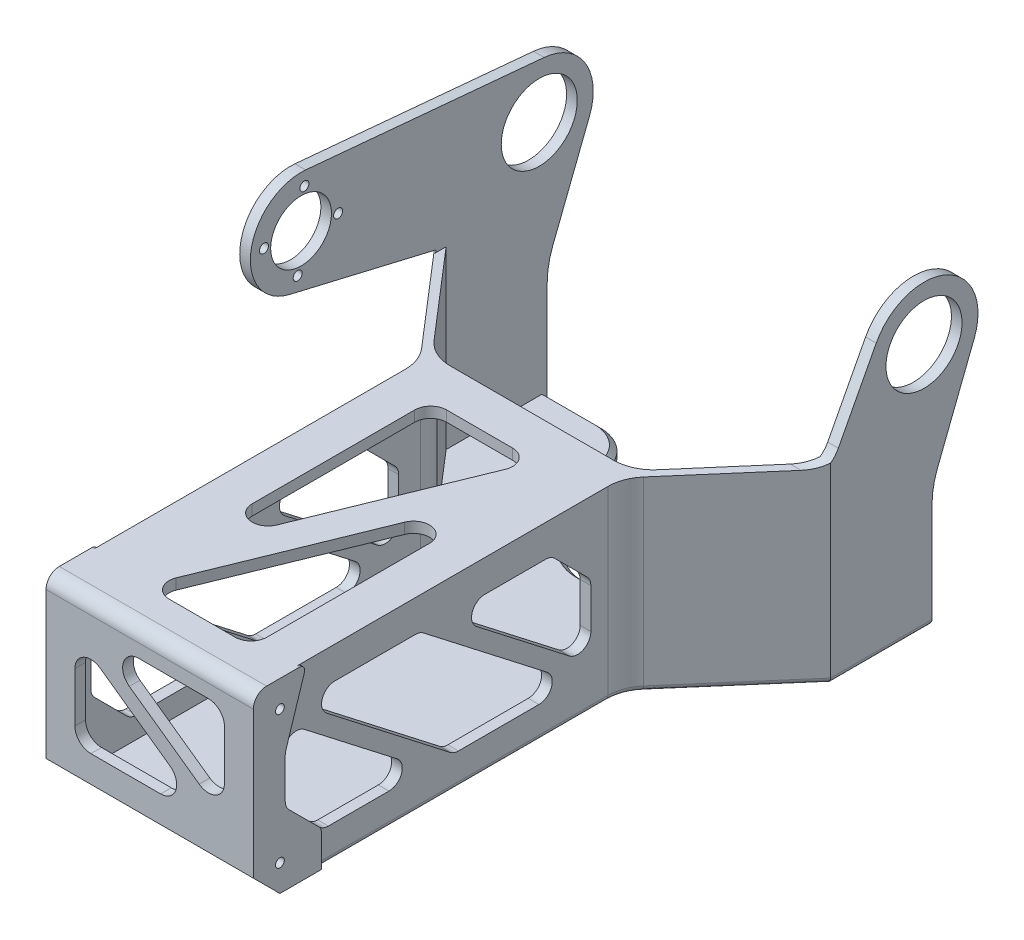
from build123d import *

# Parameters (mm, degrees)
BOSS_EXTRUDE1_DEPTH = 76
SKETCH2_W           = 148.59
SKETCH2_H           = 70
BOSS_EXTRUDE2_DEPTH = 4
SKETCH3_R           = 1.5499999999999932
CUT_EXTRUDE1_DEPTH  = 183.69917378028836
BOSS_EXTRUDE3_DEPTH = 70
CUT_EXTRUDE2_DEPTH  = 275.3120086689608
BOSS_EXTRUDE4_DEPTH = 66
CHAMFER1_SIZE       = 10
SHELL2_START        = 11.656854249
SHELL2_DEPTH        = 54.343145751
SHELL2_START_2      = 40.195
SHELL2_2_DEPTH      = 68.2
SHELL2_START_3      = 4
SHELL2_3_DEPTH      = 7.656854249
CUT_EXTRUDE3_DEPTH  = 10
FILLET4_R           = 15
FILLET5_R           = 15
SKETCH10_R          = 14.287500000000005
BOSS_EXTRUDE5_DEPTH = 4
FILLET8_R           = 30
SKETCH12_R          = 1.7000000000000146
SKETCH12_R_2        = 1.7000000000000066
SKETCH12_R_3        = 1.7000000000000015
SKETCH12_R_4        = 11.430000000000005
BOSS_EXTRUDE6_DEPTH = 4
CUT_EXTRUDE4_DEPTH  = 276.0616936327746
CHAMFER2_SIZE       = 15
FILLET9_R           = 5
FILLET10_R          = 5
FILLET11_R          = 5
CUT_EXTRUDE5_DEPTH  = 10
FILLET12_R          = 6
CUT_EXTRUDE7_DEPTH  = 10
FILLET13_R          = 6
SKETCH16_R          = 1.6500000000000166
SKETCH16_R_2        = 1.6499999999999886
CUT_EXTRUDE8_DEPTH  = 276.0616936327746
SKETCH17_R          = 1.6500000000000166
SKETCH17_R_2        = 1.6499999999999886
BOSS_EXTRUDE7_DEPTH = 0.85
FILLET14_R          = 15
FILLET15_R          = 15
FILLET16_R          = 15
FILLET17_R          = 5
FILLET18_R          = 2
CHAMFER3_SIZE       = 2
FILLET19_R          = 2
FILLET20_R          = 2
FILLET21_R          = 10
FILLET22_R          = 0.5


with BuildPart() as part:
    # Sketch1 → Boss-Extrude1 (new body)
    with BuildSketch(Plane.XY):
        Polygon((4, 4), (4, 66), (4, 70), (0, 70), (0, 0), (148.59, 0), (148.59, 70), (144.59, 70), (144.59, 66), (144.59, 4), align=None)
    extrude(amount=BOSS_EXTRUDE1_DEPTH)

    # Sketch2 → Boss-Extrude2 (add)
    with BuildSketch(Plane.XY.offset(76)):
        with Locations((74.295, 35)):
            Rectangle(SKETCH2_W, SKETCH2_H)
    extrude(amount=BOSS_EXTRUDE2_DEPTH)

    # Sketch3 → Cut-Extrude1 (cut, through all)
    with BuildSketch(Plane(origin=(148.59, 0, 0), x_dir=(0, 0, -1), z_dir=(1, 0, 0))):
        with Locations((-70, 60.00000000000001)):
            Circle(SKETCH3_R)
        with Locations((-65.08996776509676, 59.055763031749386)):
            Circle(SKETCH3_R)
    extrude(amount=-CUT_EXTRUDE1_DEPTH, mode=Mode.SUBTRACT)

    # Sketch4 → Boss-Extrude3 (add)
    with BuildSketch(Plane.XZ):
        Polygon((36.195000000000036, 80), (112.39500000000002, 80), (112.39500000000001, 219.70000000000002), (36.195000000000014, 219.70000000000002), align=None)
    extrude(amount=-BOSS_EXTRUDE3_DEPTH)

    # Sketch5 → Cut-Extrude2 (cut, through all)
    with BuildSketch(Plane(origin=(0, 70, 0), x_dir=(1, 0, 0), z_dir=(0, 1, 0))):
        Polygon((144.59, -76), (144.59, -42.73047382235106), (115.85036992840097, -76), align=None)
        Polygon((148.59, -80), (148.59, -38.1), (144.59, -42.73047382235105), (144.59, -76), (115.85036992840097, -76), (112.39500000000002, -80), align=None)
        Polygon((32.747857142857136, -75.99999999999997), (3.999999999999995, -42.64152507252382), (4, -76), align=None)
        Polygon((3.999999999999995, -42.64152507252382), (0, -38), (0, -80), (36.19500000000002, -80), (32.747857142857136, -75.99999999999997), (4, -76), align=None)
    extrude(amount=-CUT_EXTRUDE2_DEPTH, mode=Mode.SUBTRACT)

    # Sketch5<3> → Boss-Extrude4 (add)
    with BuildSketch(Plane(origin=(0, 70, 0), x_dir=(1, 0, 0), z_dir=(0, 1, 0))):
        Polygon((144.59, -42.73047382235106), (144.59, -38), (111.84214285714287, -76), (115.85036992840097, -76), align=None)
        Polygon((4, -38), (4, -42.64152507252382), (32.747857142857136, -75.99999999999997), (36.747857142857185, -76), align=None)
    extrude(amount=-BOSS_EXTRUDE4_DEPTH)

    # Chamfer1
    chamfer1_edges = [part.edges().sort_by_distance(p)[0] for p in [
        (74.29500000000002, 0, 219.70000000000002),
    ]]
    chamfer(chamfer1_edges, length=CHAMFER1_SIZE)

    # Shell2: read off the stored shape, not the designer's step
    # Shell2 outline → Shell2 (cut)
    with BuildSketch(Plane(origin=(0, 0, 0), x_dir=(1, 0, 0), z_dir=(0, 1, 0)).offset(SHELL2_START)):
        Polygon((40.195, -215.7), (108.395, -215.7), (108.395, -78.511545173), (110.564579416, -76), (38.028273213, -76), (40.195, -78.514229176), align=None)
    extrude(amount=SHELL2_DEPTH, mode=Mode.SUBTRACT)

    # Shell2 2 outline → Shell2 2 (cut)
    with BuildSketch(Plane.YZ.offset(SHELL2_START_2)):
        Polygon((11.656854249, 215.7), (4, 208.043145751), (4, 76), (11.656854249, 76), align=None)
    extrude(amount=SHELL2_2_DEPTH, mode=Mode.SUBTRACT)

    # Shell2 3 outline → Shell2 3 (cut)
    with BuildSketch(Plane(origin=(0, 0, 0), x_dir=(1, 0, 0), z_dir=(0, 1, 0)).offset(SHELL2_START_3)):
        Polygon((40.195, -76), (38.028273213, -76), (40.195, -78.514229176), align=None)
        Polygon((110.564579416, -76), (108.395, -76), (108.395, -78.511545173), align=None)
    extrude(amount=SHELL2_3_DEPTH, mode=Mode.SUBTRACT)

    # Sketch8 → Cut-Extrude3 (cut)
    with BuildSketch(Plane(origin=(0, 4, 0), x_dir=(1, 0, 0), z_dir=(0, 1, 0))):
        Polygon((109.58999999999999, 0), (39, 0), (39.00000000000001, -24.999505293349024), (63.26091939608469, -53.151421708200694), (85.32908060391533, -53.15142170820071), (109.58999999999999, -24.99950529334902), align=None)
    extrude(amount=-CUT_EXTRUDE3_DEPTH, mode=Mode.SUBTRACT)

    # Fillet4
    fillet4_edges = [part.edges().sort_by_distance(p)[0] for p in [
        (85.32908060391533, 2, 53.15142170820071),
        (63.26091939608469, 2, 53.151421708200694),
    ]]
    fillet(fillet4_edges, radius=FILLET4_R)

    # Fillet5
    fillet5_edges = [part.edges().sort_by_distance(p)[0] for p in [
        (109.58999999999999, 2, 0),
        (39, 2, 0),
        (109.58999999999999, 2, 24.99950529334902),
        (39.00000000000001, 2, 24.999505293349024),
    ]]
    fillet(fillet5_edges, radius=FILLET5_R)

    # Sketch10 → Boss-Extrude5 (add)
    with BuildSketch(Plane.ZY):
        with BuildLine():
            Line((0, 45.00000000000001), (0, 70))
            Line((0, 70), (38, 70))
            Line((38, 70), (20.959871671983425, 102.43534131740273))
            ThreePointArc((20.959871671983425, 102.43534131740273), (-5.427511917217222, 111.45425964744081), (-15.892146352821499, 85.60611993378485))
            Line((-15.892146352821499, 85.60611993378485), (0, 45.00000000000001))
        make_face()
        with Locations((2.9999999999999933, 93)):
            Circle(SKETCH10_R, mode=Mode.SUBTRACT)
    boss_extrude5 = extrude(amount=-BOSS_EXTRUDE5_DEPTH)

    # Mirror1: Boss-Extrude5 across plane
    add(boss_extrude5.mirror(Plane.ZY.offset(-74.29500000000004)))

    # Fillet8
    fillet8_edges = [part.edges().sort_by_distance(p)[0] for p in [
        (2, 45.00000000000001, 0),
        (146.5900000000001, 45.00000000000001, 1.795e-14),
    ]]
    fillet(fillet8_edges, radius=FILLET8_R)

    # Sketch12 → Boss-Extrude6 (add)
    with BuildSketch(Plane.ZY):
        with BuildLine():
            Line((90.76820759029594, 121.40410157682716), (1.151178688988905, 113.20308184436105))
            ThreePointArc((1.1511786889889044, 113.20308184436105), (12.689042496031862, 110.82428432672933), (20.959871646987697, 102.4353413649813))
            Line((20.9598716469877, 102.4353413649813), (38, 70))
            Line((38, 70), (96.87897356250058, 83.89248769804969))
            ThreePointArc((96.87897356250066, 83.89248769804931), (111.30640681817987, 105.49630322842616), (90.76820759029599, 121.40410157682683))
        make_face()
        with Locations((91.23484052030747, 116.37108217392239)):
            Circle(SKETCH12_R, mode=Mode.SUBTRACT)
        with Locations((93.77366791719297, 88.4956585881036)):
            Circle(SKETCH12_R_2, mode=Mode.SUBTRACT)
        with Locations((78.56654242584088, 101.16395668257017)):
            Circle(SKETCH12_R_3, mode=Mode.SUBTRACT)
        with Locations((92.5042542187503, 102.43337038101281)):
            Circle(SKETCH12_R_4, mode=Mode.SUBTRACT)
        with Locations((106.44196601165967, 103.70278407945571)):
            Circle(SKETCH12_R, mode=Mode.SUBTRACT)
    extrude(amount=-BOSS_EXTRUDE6_DEPTH)

    # Sketch13 → Cut-Extrude4 (cut, through all)
    with BuildSketch(Plane(origin=(112.39500000000004, 0, 1.117e-14), x_dir=(1e-16, 0, -1), z_dir=(1, 0, 1e-16))):
        Polygon((-202.80362192896834, 58.00000000000002), (-143.4683405547297, 12.000000000000014), (-96.89637807103179, 12), (-156.23165944527034, 58.00000000000002), align=None)
        Polygon((-153.26109669679317, 12.000000000000014), (-207.7, 54.20405623684717), (-207.7, 15), (-207.7, 12), align=None)
        Polygon((-91.99999999999999, 58.00000000000001), (-146.4389033032069, 58.00000000000001), (-91.99999999999999, 15.795943763152833), align=None)
    extrude(amount=-CUT_EXTRUDE4_DEPTH, mode=Mode.SUBTRACT)

    # Chamfer2
    chamfer2_edges = [part.edges().sort_by_distance(p)[0] for p in [
        (38.19500000000002, 58.00000000000001, 91.99999999999999),
        (110.39500000000001, 58.00000000000001, 92),
        (38.19500000000001, 12, 207.7),
        (110.39500000000001, 12, 207.7),
    ]]
    chamfer(chamfer2_edges, length=CHAMFER2_SIZE)

    # Fillet9
    fillet9_edges = [part.edges().sort_by_distance(p)[0] for p in [
        (38.19500000000002, 12.000000000000007, 143.4683405547297),
        (38.19500000000001, 58.00000000000002, 202.80362192896834),
        (38.19500000000001, 58.000000000000014, 156.23165944527034),
        (38.19500000000002, 12.000000000000014, 96.89637807103179),
        (38.19500000000002, 15.795943763152833, 91.99999999999999),
        (38.19500000000002, 58.000000000000014, 146.4389033032069),
        (38.19500000000001, 12.000000000000014, 153.26109669679317),
        (38.195000000000014, 58.00000000000001, 106.99999999999999),
        (38.19500000000002, 43.00000000000001, 91.99999999999999),
        (38.19500000000001, 12, 192.7),
        (38.19500000000001, 26.999999999999996, 207.7),
    ]]
    fillet(fillet9_edges, radius=FILLET9_R)

    # Fillet10
    fillet10_edges = [part.edges().sort_by_distance(p)[0] for p in [
        (38.19500000000001, 54.20405623684717, 207.7),
    ]]
    fillet(fillet10_edges, radius=FILLET10_R)

    # Fillet11
    fillet11_edges = [part.edges().sort_by_distance(p)[0] for p in [
        (110.39500000000001, 12.000000000000007, 143.4683405547297),
        (110.39500000000001, 58.00000000000002, 202.80362192896834),
        (110.39500000000001, 58.000000000000014, 156.23165944527034),
        (110.39500000000001, 12.000000000000014, 96.8963780710318),
        (110.39500000000001, 15.795943763152833, 92),
        (110.39500000000001, 58.000000000000014, 146.4389033032069),
        (110.39500000000001, 12.000000000000014, 153.26109669679317),
        (110.39500000000001, 54.20405623684717, 207.7),
        (110.39500000000002, 58.00000000000001, 107),
        (110.39500000000001, 43.00000000000001, 92),
        (110.39500000000001, 12, 192.7),
        (110.39500000000001, 26.999999999999996, 207.7),
    ]]
    fillet(fillet11_edges, radius=FILLET11_R)

    # Sketch14 → Cut-Extrude5 (cut)
    with BuildSketch(Plane.XY.offset(219.70000000000002)):
        Polygon((46.195000000000014, 56.31771636400354), (97.22139149142498, 20.00000000000004), (46.195000000000014, 20.00000000000004), align=None)
        Polygon((51.36860850857504, 60.000000000000014), (102.39500000000001, 23.68228363599649), (102.39500000000001, 60.00000000000001), align=None)
    extrude(amount=-CUT_EXTRUDE5_DEPTH, mode=Mode.SUBTRACT)

    # Fillet12
    fillet12_edges = [part.edges().sort_by_distance(p)[0] for p in [
        (46.195000000000014, 20.00000000000004, 217.7),
        (46.195000000000014, 56.31771636400354, 217.7),
        (97.22139149142498, 20.00000000000004, 217.7),
        (51.36860850857504, 60.000000000000014, 217.7),
        (102.39500000000001, 60.00000000000001, 217.7),
        (102.39500000000001, 23.68228363599649, 217.7),
    ]]
    fillet(fillet12_edges, radius=FILLET12_R)

    # Sketch15 → Cut-Extrude7 (cut)
    with BuildSketch(Plane(origin=(0, 70, 0), x_dir=(1, 0, 0), z_dir=(0, 1, 0))):
        Polygon((57.671404733272716, -204.7), (97.39500000000001, -106.93868437604128), (97.39500000000001, -204.7), align=None)
        Polygon((51.19499999999999, -188.76131562395886), (90.9185952667273, -91), (51.19500000000003, -91), align=None)
    extrude(amount=-CUT_EXTRUDE7_DEPTH, mode=Mode.SUBTRACT)

    # Fillet13
    fillet13_edges = [part.edges().sort_by_distance(p)[0] for p in [
        (97.39500000000001, 68, 106.93868437604128),
        (97.39500000000001, 68, 204.7),
        (57.671404733272716, 68, 204.7),
        (51.19500000000003, 68, 91),
        (90.9185952667273, 68, 91),
        (51.19499999999999, 68, 188.76131562395886),
    ]]
    fillet(fillet13_edges, radius=FILLET13_R)

    # Sketch16 → Cut-Extrude8 (cut, through all)
    with BuildSketch(Plane(origin=(112.39500000000004, 0, 1.117e-14), x_dir=(1e-16, 0, -1), z_dir=(1, 0, 1e-16))):
        with Locations(Location((-209.69999999999996, 10.000000000000037, 0), (0, 0, 180))):
            Circle(SKETCH16_R)
        with Locations(Location((-209.69999999999996, 60.00000000000004, 0), (0, 0, 180))):
            Circle(SKETCH16_R_2)
    extrude(amount=-CUT_EXTRUDE8_DEPTH, mode=Mode.SUBTRACT)

    # Sketch17 → Boss-Extrude7 (add)
    with BuildSketch(Plane(origin=(112.39500000000004, 0, 1.117e-14), x_dir=(1e-16, 0, -1), z_dir=(1, 0, 1e-16))):
        with BuildLine():
            Line((-194.16446609406714, 0), (-194.16446609406714, 13.464466094067243))
            Line((-194.16446609406714, 13.464466094067243), (-206.23553390593273, 25.53553390593269))
            ThreePointArc((-206.23553390593273, 25.53553390593269), (-207.3193976625564, 27.157650650039994), (-207.7, 29.071067811865447))
            Line((-207.7, 29.071067811865447), (-207.7, 44.001206070392804))
            ThreePointArc((-207.7, 44.001206070392804), (-207.64026315438892, 44.77179024190636), (-207.4624800138451, 45.523961506346296))
            Line((-207.4624800138451, 45.523961506346296), (-199.636511073615, 70))
            Line((-199.636511073615, 70), (-219.70000000000002, 70))
            Line((-219.70000000000002, 70), (-219.70000000000002, 10.000000000000037))
            Line((-219.70000000000002, 10.000000000000037), (-209.69999999999993, 0))
            Line((-209.69999999999993, 0), (-194.16446609406714, 0))
        make_face()
        with Locations(Location((-209.69999999999996, 10.000000000000037, 0), (0, 0, 180))):
            Circle(SKETCH17_R, mode=Mode.SUBTRACT)
        with Locations(Location((-209.69999999999996, 60.00000000000004, 0), (0, 0, 180))):
            Circle(SKETCH17_R_2, mode=Mode.SUBTRACT)
    boss_extrude7 = extrude(amount=BOSS_EXTRUDE7_DEPTH)

    # Mirror2: Boss-Extrude7 across plane
    add(boss_extrude7.mirror(Plane.ZY.offset(-74.29500000000004)))

    # Fillet14
    fillet14_edges = [part.edges().sort_by_distance(p)[0] for p in [
        (112.39500000000002, 35, 80),
        (36.195000000000036, 35, 79.99999999999999),
    ]]
    fillet(fillet14_edges, radius=FILLET14_R)

    # Fillet15
    # the kernel refuses this fillet: 15 mm, written as the material it takes off along each edge
    with BuildSketch(Plane(origin=(40.195, 4, 78.514229176), x_dir=(-0.6528165227409023, 0, -0.7575160642761822), z_dir=(0, 1, 0))) as fillet15_piece_1:
        with BuildLine():
            CenterArc((5.814125452973189, 14.791030009002753), FILLET15_R, 229.24570623981754, 31.17927910907173)
            Line((-3.9781223881403447, 3.4282890448600196), (0, 0))
            Line((0, 0), (3.319044036910781, 3e-17))
        make_face()
    extrude(amount=62, mode=Mode.SUBTRACT)
    with BuildSketch(Plane(origin=(108.395, 66, 78.511545173), x_dir=(0.6537092077500729, 0, -0.7567458435318768), z_dir=(0, -1, 0))) as fillet15_piece_2:
        with BuildLine():
            CenterArc((5.825963566490703, 14.788999593754832), FILLET15_R, 229.1781524338725, 31.200319410695272)
            Line((-3.9796745497603907, 3.4378119407766805), (0, 0))
            Line((0, 0), (3.3188754116945365, 2.1e-16))
        make_face()
    extrude(amount=62, mode=Mode.SUBTRACT)

    # Fillet16
    fillet16_edges = [part.edges().sort_by_distance(p)[0] for p in [
        (111.84214285714287, 37, 76),
        (36.747857142857185, 37, 76),
    ]]
    fillet(fillet16_edges, radius=FILLET16_R)

    # Fillet17
    fillet17_edges = [part.edges().sort_by_distance(p)[0] for p in [
        (74.29500000000002, 70, 219.70000000000002),
    ]]
    fillet(fillet17_edges, radius=FILLET17_R)

    # Fillet18
    fillet18_edges = [part.edges().sort_by_distance(p)[0] for p in [
        (112.39500000000002, 0, 139.87308584821457),
        (148.59, 0, 19.05),
        (0, 0, 19),
        (36.19500000000003, 0, 139.86805334131594),
        (132.31690617367988, 0, 56.93803374285986),
        (35.25631420751695, 0, 80.34866799075391),
        (113.33676727341586, 0, 80.35044451107643),
        (16.278870482834492, 0, 56.889696374611084),
    ]]
    fillet(fillet18_edges, radius=FILLET18_R)

    # Chamfer3
    chamfer3_edges = [part.edges().sort_by_distance(p)[0] for p in [
        (134.59, 4, 0),
        (74.29499999999999, 4, 53.1514217082007),
        (84.7039573405079, 4, 51.78747167859423),
        (63.886042659492084, 4, 51.7874716785942),
        (14, 4, 0),
        (39.00000000000001, 4, 17.213932352392163),
        (109.58999999999999, 4, 17.213932352392163),
        (97.8848939925897, 4, 38.58189104583507),
        (50.70510600741031, 4, 38.58189104583507),
        (113.98339828220178, 4, 4.393398282201787),
        (34.60660171779823, 4, 4.393398282201787),
        (39.93868579248309, 4, 24.650837302595175),
        (108.6513142075169, 4, 24.650837302595168),
    ]]
    chamfer(chamfer3_edges, length=CHAMFER3_SIZE)

    # Fillet19
    fillet19_edges = [part.edges().sort_by_distance(p)[0] for p in [
        (112.82000000000002, 70, 199.636511073615),
        (35.770000000000024, 70, 199.636511073615),
    ]]
    fillet(fillet19_edges, radius=FILLET19_R)

    # Fillet20
    fillet20_edges = [part.edges().sort_by_distance(p)[0] for p in [
        (112.82000000000002, 13.464466094067243, 194.16446609406714),
        (35.770000000000024, 13.464466094067243, 194.16446609406714),
    ]]
    fillet(fillet20_edges, radius=FILLET20_R)

    # Fillet21
    # the kernel refuses this fillet: 10 mm, written as the material it adds along each edge
    with BuildSketch(Plane(origin=(148.5900000000001, 70, 38.00000000000002), x_dir=(-2.5e-16, 0, 1), z_dir=(-1, 0, -2.5e-16))) as fillet21_piece_1_section:
        with BuildLine():
            CenterArc((FILLET21_R * 0.604244776818, FILLET21_R), FILLET21_R, 207.71549809984168, 62.28450190015832)
            Line((-FILLET21_R * 0.281023080088, FILLET21_R * 0.534918478621), (0, 0))
            Line((0, 0), (FILLET21_R * 0.604244776818, 0))
        make_face()
    fillet21_piece_1 = extrude(amount=4, mode=Mode.PRIVATE)
    fillet21_piece_1 = split(fillet21_piece_1, bisect_by=Plane(origin=(146.2946776488375, 70, 36.02192398808742), z_dir=(0.7575160643779294, 0, 0.6528165226228367)), keep=Keep.TOP, mode=Mode.PRIVATE)
    fillet21_piece_1 = split(fillet21_piece_1, bisect_by=Plane(origin=(148.6394691725848, 70, 38.04273357283305), z_dir=(-0.7567458435093486, 0, -0.6537092077761523)), keep=Keep.TOP, mode=Mode.PRIVATE)
    add(fillet21_piece_1)
    with BuildSketch(Plane(origin=(148.5900000000001, 70, 38.00000000000002), x_dir=(-2.5e-16, 0, 1), z_dir=(-1, 0, -2.5e-16))) as fillet21_piece_2_section:
        with BuildLine():
            CenterArc((FILLET21_R * 0.604244776818, FILLET21_R), FILLET21_R, 207.71549809984168, 62.28450190015832)
            Line((-FILLET21_R * 0.281023080088, FILLET21_R * 0.534918478621), (0, 0))
            Line((0, 0), (FILLET21_R * 0.604244776818, 0))
        make_face()
    fillet21_piece_2 = extrude(amount=4, mode=Mode.PRIVATE)
    fillet21_piece_2 = split(fillet21_piece_2, bisect_by=Plane(origin=(146.2946776488375, 70, 36.02192398808742), z_dir=(-0.7575160643779294, 0, -0.6528165226228367)), keep=Keep.TOP, mode=Mode.PRIVATE)
    add(fillet21_piece_2)
    with BuildSketch(Plane(origin=(148.5900000000001, 70, 38.00000000000002), x_dir=(-2.5e-16, 0, 1), z_dir=(-1, 0, -2.5e-16))) as fillet21_piece_3_section:
        with BuildLine():
            CenterArc((FILLET21_R * 0.604244776818, FILLET21_R), FILLET21_R, 207.71549809984168, 62.28450190015832)
            Line((-FILLET21_R * 0.281023080088, FILLET21_R * 0.534918478621), (0, 0))
            Line((0, 0), (FILLET21_R * 0.604244776818, 0))
        make_face()
    fillet21_piece_3 = extrude(amount=19.106119420456565, mode=Mode.PRIVATE)
    fillet21_piece_3 = split(fillet21_piece_3, bisect_by=Plane(origin=(146.2946776488375, 70, 36.02192398808742), z_dir=(0.7575160643779294, 0, 0.6528165226228367)), keep=Keep.TOP, mode=Mode.PRIVATE)
    fillet21_piece_3 = split(fillet21_piece_3, bisect_by=Plane(origin=(148.6394691725848, 70, 38.04273357283304), z_dir=(-0.7567458435093486, 0, -0.6537092077761523)), keep=Keep.TOP, mode=Mode.PRIVATE)
    fillet21_piece_3 = split(fillet21_piece_3, bisect_by=Plane(origin=(144.59, 70, 38.00000000000002), z_dir=(-1, 0, 0)), keep=Keep.TOP, mode=Mode.PRIVATE)
    add(fillet21_piece_3)

    # Fillet22
    # the kernel refuses this fillet: 0.5 mm, written as the material it adds along each edge
    with BuildSketch(Plane(origin=(-10.740941226510579, 70, 38), x_dir=(0, 0, 1), z_dir=(1, 0, 0))) as fillet22_piece_1_section:
        with BuildLine():
            CenterArc((FILLET22_R * 8.59275298121, -FILLET22_R), FILLET22_R, 90, 166.72388301336812)
            Line((FILLET22_R * 8.36310892117, -FILLET22_R * 1.97327468152), (0, 0))
            Line((0, 0), (FILLET22_R * 8.59275298121, 0))
        make_face()
    fillet22_piece_1 = extrude(amount=14.740941226510579, mode=Mode.PRIVATE)
    fillet22_piece_1 = split(fillet22_piece_1, bisect_by=Plane(origin=(-4.57746060907744, 70, 32.688400453619224), z_dir=(0.7575160643779291, 0, -0.6528165226228371)), keep=Keep.TOP, mode=Mode.PRIVATE)
    add(fillet22_piece_1)


solid = part.part
